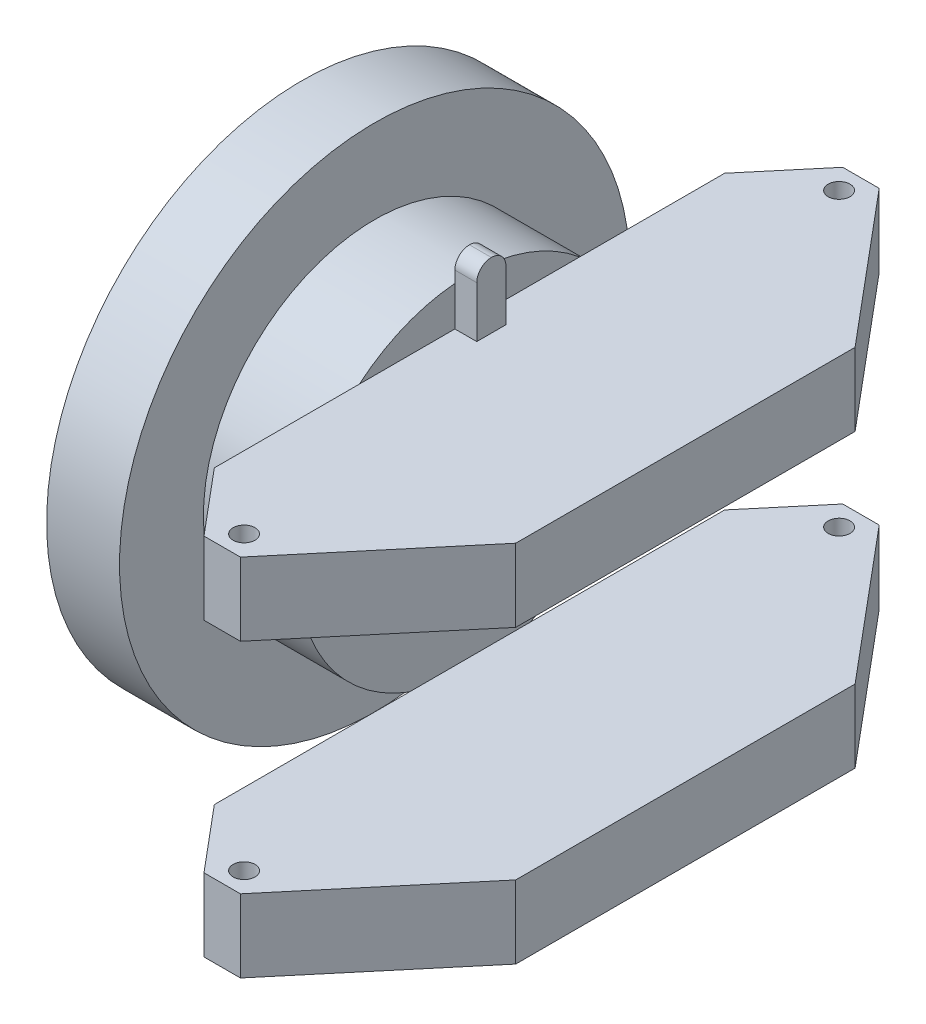
from build123d import *

# Parameters (mm, degrees)
SKETCH1_R               = 35
BOSS_EXTRUDE1_DEPTH     = 10
SKETCH2_R               = 23.5
BOSS_EXTRUDE2_DEPTH     = 13
BOSS_EXTRUDE3_DEPTH     = 5
SKETCH5_R               = 1.5
CUT_EXTRUDE1_DEPTH      = 87.587143002
SKETCH9_W               = 4
SKETCH9_H               = 9
BOSS_EXTRUDE8_DEPTH     = 3
FILLET3_R               = 2
SKETCH11_R              = 10
CUT_EXTRUDE2_DEPTH      = 10
MIRROR2_COPY_1_SKETCH_R = 1.5
MIRROR2_COPY_1_DEPTH    = 87.587143002
FILLET3_OF_MIRROR2_R    = 2


with BuildPart() as part:
    # Sketch1 → Boss-Extrude1 (new body)
    with BuildSketch(Plane(origin=(0, 0, 0), x_dir=(0, 0, -1), z_dir=(1, 0, 0))):
        Circle(SKETCH1_R)
    extrude(amount=BOSS_EXTRUDE1_DEPTH)

    # Sketch2 → Boss-Extrude2 (add)
    with BuildSketch(Plane(origin=(10, 0, 0), x_dir=(0, 0, -1), z_dir=(1, 0, 0))):
        with Locations(Location((0, 0, 0), (0, 0, 180))):
            Circle(SKETCH2_R)
    extrude(amount=BOSS_EXTRUDE2_DEPTH)

    # Sketch4 → Boss-Extrude3 (add, symmetric)
    with BuildSketch(Plane(origin=(0, 13, 0), x_dir=(1, 0, 0), z_dir=(0, 1, 0))):
        Polygon((23, 35), (23, -35), (30.392057511, -43.809511096), (35.392057511, -43.809511096), (52.621859248, -23.275832977), (52.621859248, 23.275832977), (35.392057511, 43.809511096), (30.392057511, 43.809511096), align=None)
    boss_extrude3 = extrude(amount=BOSS_EXTRUDE3_DEPTH, both=True)

    # Sketch5 → Cut-Extrude1 (cut, through all)
    with BuildSketch(Plane(origin=(0, 18, 0), x_dir=(1, 0, 0), z_dir=(0, 1, 0))):
        with Locations(Location((32.892057511, -40.809511096, 0), (0, 0, 270))):
            Circle(SKETCH5_R)
    cut_extrude1 = extrude(amount=-CUT_EXTRUDE1_DEPTH, mode=Mode.SUBTRACT)

    # Mirror1: Cut-Extrude1 across plane
    add(cut_extrude1.mirror(Plane.XY), mode=Mode.SUBTRACT)

    # Sketch9 → Boss-Extrude8 (add)
    with BuildSketch(Plane(origin=(23, 0, 0), x_dir=(0, 0, -1), z_dir=(1, 0, 0))):
        with Locations((0, 22.5)):
            Rectangle(SKETCH9_W, SKETCH9_H)
    boss_extrude8 = extrude(amount=BOSS_EXTRUDE8_DEPTH)

    # Fillet3
    fillet3_edges = [part.edges().sort_by_distance(p)[0] for p in [
        (24.5, 27, -2),
        (24.5, 27, 2),
    ]]
    fillet(fillet3_edges, radius=FILLET3_R - 0.0001)  # a hair under: the kernel refuses the full size

    # Sketch11 → Cut-Extrude2 (cut)
    with BuildSketch(Plane.ZY):
        Circle(SKETCH11_R)
    extrude(amount=-CUT_EXTRUDE2_DEPTH, mode=Mode.SUBTRACT)

    # Mirror2: Boss-Extrude3, Cut-Extrude1, Boss-Extrude8 across plane
    add(boss_extrude3.mirror(Plane(origin=(0, -7, 0), x_dir=(0, 0, 1), z_dir=(0, -1, 0))))
    add(cut_extrude1.mirror(Plane(origin=(0, -7, 0), x_dir=(0, 0, 1), z_dir=(0, -1, 0))), mode=Mode.SUBTRACT)
    add(boss_extrude8.mirror(Plane(origin=(0, -7, 0), x_dir=(0, 0, 1), z_dir=(0, -1, 0))))

    # Mirror2 copy 1 sketch → Mirror2 copy 1 (cut, through all)
    with BuildSketch(Plane.XZ.offset(32)):
        with Locations(Location((32.892057511, -40.809511096, 0), (0, 0, 270))):
            Circle(MIRROR2_COPY_1_SKETCH_R)
    extrude(amount=-MIRROR2_COPY_1_DEPTH, mode=Mode.SUBTRACT)

    # Fillet3 of Mirror2
    fillet3_of_mirror2_edges = [part.edges().sort_by_distance(p)[0] for p in [
        (24.5, -41, -2),
        (24.5, -41, 2),
    ]]
    fillet(fillet3_of_mirror2_edges, radius=FILLET3_OF_MIRROR2_R - 0.0001)  # a hair under: the kernel refuses the full size


solid = part.part
